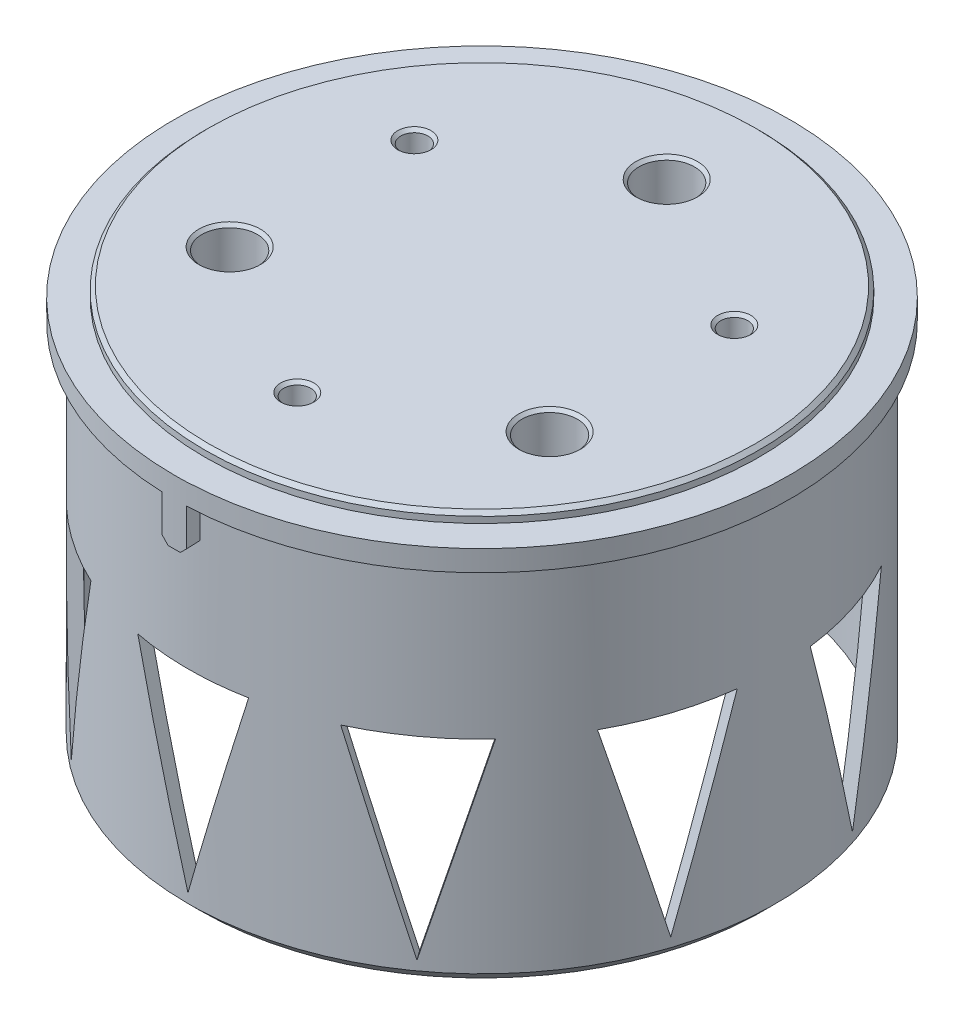
from build123d import *

# Parameters (mm, degrees)
CUT_EXTRUDE_651_DEPTH      = 70.85
PATTERN_CIRCULAR_705_COUNT = 5
SKETCH_7_R                 = 50
EXTRUDE_1_DEPTH            = 5
CUT_EXTRUDE_START          = -1.6
SKETCH_8_R                 = 50
SKETCH_8_R_2               = 45
CUT_EXTRUDE_1_DEPTH        = 1.6
SKETCH_10_R                = 4.5
CUT_EXTRUDE_4_DEPTH        = 97.046863561
SKETCH_10_4_R              = 2.2
CUT_EXTRUDE_5_DEPTH        = 8
CHAMFER_1_SIZE             = 0.5
EXTRUDE_START              = 7
EXTRUDE_2_DEPTH            = 7
CHAMFER_4_SIZE             = 1
CHAMFER_5_SIZE             = 2
CHAMFER_6_SIZE             = 5
CHAMFER_7_SIZE             = 0.6


with BuildPart() as part:
    # Эскиз2 → Revolve 379 (revolve)
    with BuildSketch(Plane.XY, mode=Mode.PRIVATE) as revolve_379_sk:
        with BuildLine():
            Line((0, 0), (-47.75, 0))
            Line((-47.75, 0), (-47.75, -60))
            Line((-47.75, -60), (-45.75, -60))
            Line((-45.75, -60), (-45.75, -21))
            ThreePointArc((-45.75, -21), (-44.871320344, -18.878679656), (-42.75, -18))
            Line((-42.75, -18), (0, -18))
            Line((0, -18), (0, 0))
        make_face()
    revolve(revolve_379_sk.sketch.rotate(Axis((0, 0, 0), (0, 1, 0)), 270), axis=Axis((0, 0, 0), (0, 1, 0)))

    # Эскиз4 → Cut-Extrude 651 (cut, symmetric)
    with BuildSketch(Plane.XY):
        Polygon((-9, -25), (9, -25), (0, -56.5), align=None)
    cut_extrude_651 = extrude(amount=CUT_EXTRUDE_651_DEPTH, both=True, mode=Mode.SUBTRACT)

    # Pattern Circular 705: Cut-Extrude 651 ×5 about axis
    pattern_circular_705_axis = Axis((0, 0, 0), (0, 1, 0))
    for i in range(1, PATTERN_CIRCULAR_705_COUNT):
        add(cut_extrude_651.rotate(pattern_circular_705_axis, i * 360 / PATTERN_CIRCULAR_705_COUNT), mode=Mode.SUBTRACT)

    # Эскиз7 → Бобышка-Вытянуть1 (add)
    with BuildSketch(Plane(origin=(0, 0, 0), x_dir=(1, 0, 0), z_dir=(0, 1, 0))):
        with Locations(Location((0, 0, 0), (0, 0, 270))):
            Circle(SKETCH_7_R)
    extrude(amount=EXTRUDE_1_DEPTH)

    # Эскиз8 → Вырез-Вытянуть1 (cut)
    with BuildSketch(Plane(origin=(0, 5, 0), x_dir=(1, 0, 0), z_dir=(0, 1, 0)).offset(CUT_EXTRUDE_START)):
        with Locations(Location((0, 0, 0), (0, 0, 270))):
            Circle(SKETCH_8_R)
        with Locations(Location((0, 0, 0), (0, 0, 270))):
            Circle(SKETCH_8_R_2, mode=Mode.SUBTRACT)
    extrude(amount=CUT_EXTRUDE_1_DEPTH, mode=Mode.SUBTRACT)

    # Эскиз10 → Вырез-Вытянуть4 (cut, through all)
    with BuildSketch(Plane(origin=(0, 5, 0), x_dir=(1, 0, 0), z_dir=(0, 1, 0))):
        with Locations(Location((0, 30, 0), (0, 0, 270))):
            Circle(SKETCH_10_R)
        with Locations(Location((25.980762114, -15, 0), (0, 0, 270))):
            Circle(SKETCH_10_R)
        with Locations(Location((-25.980762114, -15, 0), (0, 0, 270))):
            Circle(SKETCH_10_R)
    extrude(amount=-CUT_EXTRUDE_4_DEPTH, mode=Mode.SUBTRACT)

    # Эскиз10<4> → Вырез-Вытянуть5 (cut)
    with BuildSketch(Plane(origin=(0, 5, 0), x_dir=(1, 0, 0), z_dir=(0, 1, 0))):
        with Locations(Location((0, -30, 0), (0, 0, 270))):
            Circle(SKETCH_10_4_R)
        with Locations(Location((-25.980762114, 15, 0), (0, 0, 270))):
            Circle(SKETCH_10_4_R)
        with Locations(Location((25.980762114, 15, 0), (0, 0, 270))):
            Circle(SKETCH_10_4_R)
    extrude(amount=-CUT_EXTRUDE_5_DEPTH, mode=Mode.SUBTRACT)

    # Фаска1
    chamfer_1_edges = [part.edges().sort_by_distance(p)[0] for p in [
        (0, 5, -34.5),
        (-25.980762114, 5, 10.5),
        (25.980762114, 5, 10.5),
        (-25.980762114, 5, -17.2),
        (25.980762114, 5, -17.2),
        (0, 5, 27.8),
    ]]
    chamfer(chamfer_1_edges, length=CHAMFER_1_SIZE)

    # Эскиз13 → Бобышка-Вытянуть2 (add)
    with BuildSketch(Plane.XZ.offset(EXTRUDE_START)):
        with BuildLine():
            ThreePointArc((-1.91, 47.711784708), (0, 47.75), (1.91, 47.711784708))
            Line((1.91, 47.711784708), (2, 49.959983987))
            ThreePointArc((2, 49.959983987), (0, 50), (-2, 49.959983987))
            Line((-2, 49.959983987), (-1.91, 47.711784708))
        make_face()
    extrude(amount=-EXTRUDE_2_DEPTH)

    # Фаска4
    chamfer_4_edges = [part.edges().sort_by_distance(p)[0] for p in [
        (-1.955, -7, 48.835884347),
        (1.955, -7, 48.835884347),
    ]]
    chamfer(chamfer_4_edges, length=CHAMFER_4_SIZE)

    # Фаска5
    chamfer_5_edges = [part.edges().sort_by_distance(p)[0] for p in [
        (0, -60, 47.75),
    ]]
    chamfer(chamfer_5_edges, length=CHAMFER_5_SIZE - 0.0001)  # a hair under: the kernel refuses the full size

    # Фаска6
    chamfer_6_edges = [part.edges().sort_by_distance(p)[0] for p in [
        (0, -18, -34.5),
        (-25.980762114, -18, 10.5),
        (25.980762114, -18, 10.5),
    ]]
    chamfer(chamfer_6_edges, length=CHAMFER_6_SIZE)

    # Фаска7
    chamfer_7_edges = [part.edges().sort_by_distance(p)[0] for p in [
        (0, 5, -45),
    ]]
    chamfer(chamfer_7_edges, length=CHAMFER_7_SIZE)


solid = part.part
